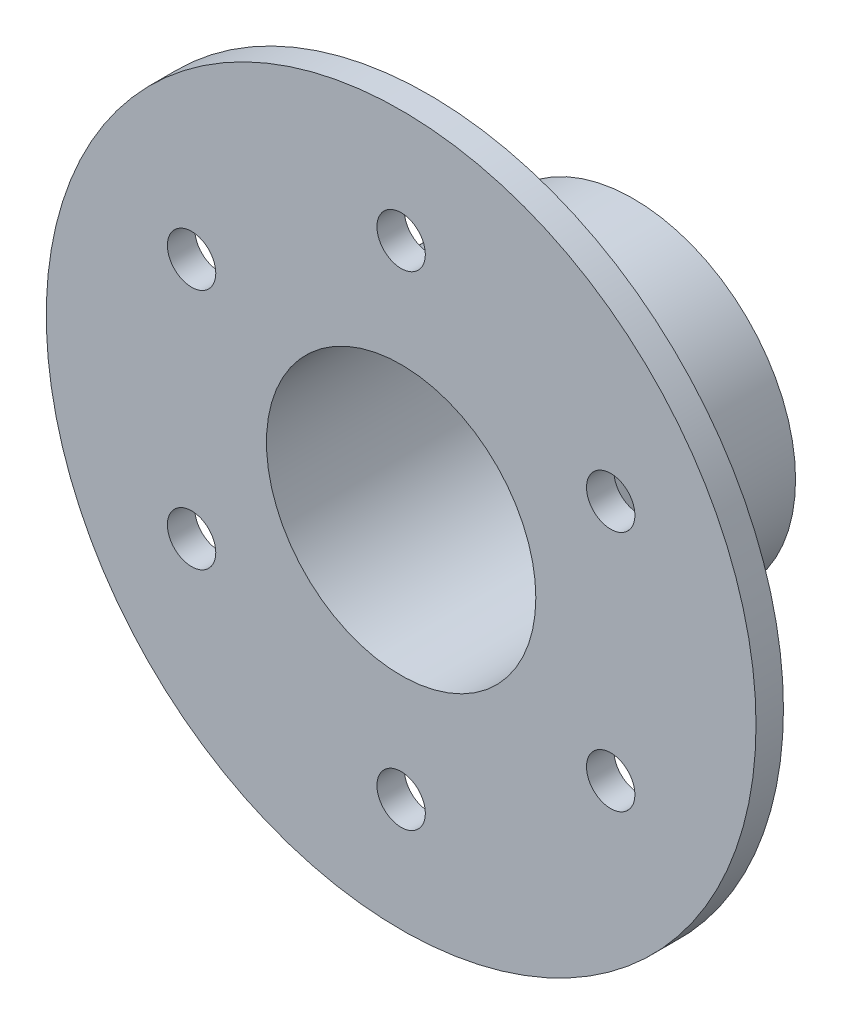
from build123d import *

# Parameters (mm, degrees)
CROQUIS1_R              = 20.1
CROQUIS1_R_2            = 16.7
SALIENTE_EXTRUIR1_DEPTH = 25.4
CROQUIS2_R              = 44
CROQUIS2_R_2            = 16.7
CROQUIS2_R_3            = 3
SALIENTE_EXTRUIR2_DEPTH = 3.4


with BuildPart() as part:
    # Croquis1 → Saliente-Extruir1 (new body)
    with BuildSketch(Plane.XY):
        Circle(CROQUIS1_R)
        Circle(CROQUIS1_R_2, mode=Mode.SUBTRACT)
    extrude(amount=SALIENTE_EXTRUIR1_DEPTH)

    # Croquis2 → Saliente-Extruir2 (add)
    with BuildSketch(Plane.XY.offset(25.4)):
        Circle(CROQUIS2_R)
        Circle(CROQUIS2_R_2, mode=Mode.SUBTRACT)
        with Locations((0, 30)):
            Circle(CROQUIS2_R_3, mode=Mode.SUBTRACT)
        with Locations((25.980762114, 15)):
            Circle(CROQUIS2_R_3, mode=Mode.SUBTRACT)
        with Locations((25.980762114, -15)):
            Circle(CROQUIS2_R_3, mode=Mode.SUBTRACT)
        with Locations((0, -30)):
            Circle(CROQUIS2_R_3, mode=Mode.SUBTRACT)
        with Locations((-25.980762114, -15)):
            Circle(CROQUIS2_R_3, mode=Mode.SUBTRACT)
        with Locations((-25.980762114, 15)):
            Circle(CROQUIS2_R_3, mode=Mode.SUBTRACT)
    extrude(amount=SALIENTE_EXTRUIR2_DEPTH)


solid = part.part
